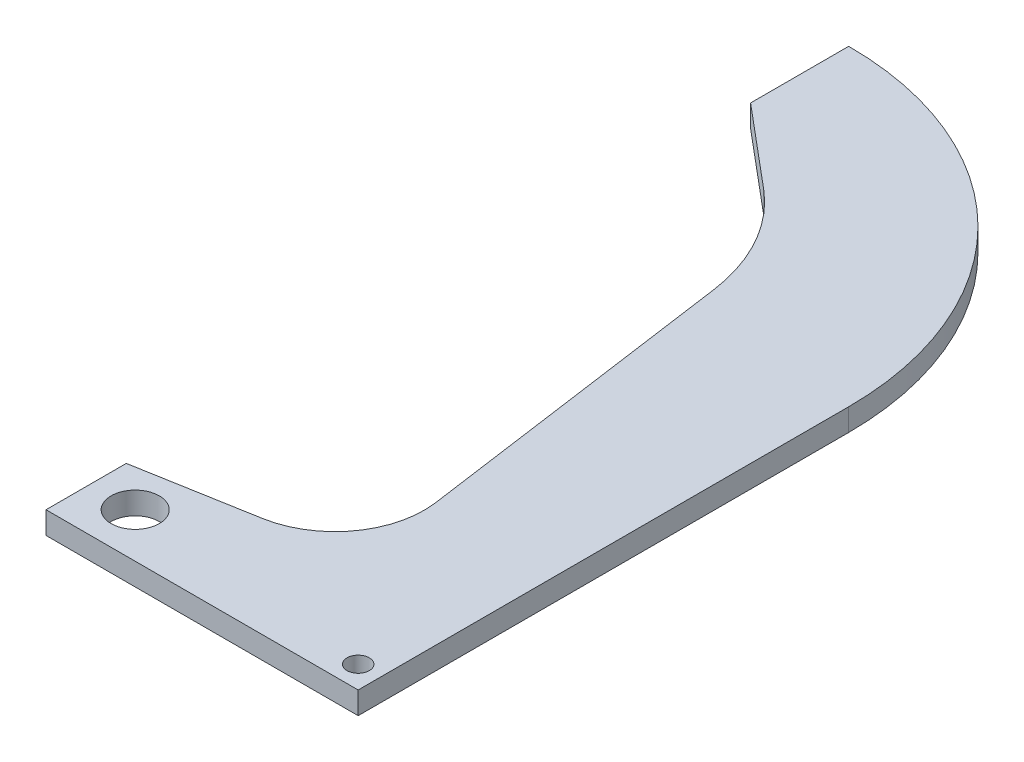
from build123d import *

# Parameters (mm, degrees)
SKETCH1_R           = 3.429
SKETCH1_R_2         = 1.5875
BOSS_EXTRUDE1_DEPTH = 3.175
CUT_EXTRUDE1_DEPTH  = 123.679962198


with BuildPart() as part:
    # Sketch1 → Boss-Extrude1 (new body)
    with BuildSketch(Plane(origin=(0, 0, 0), x_dir=(1, 0, 0), z_dir=(0, 1, 0))):
        with BuildLine():
            Line((0, 0), (44.45, 0))
            Line((44.45, 0), (44.45, 69.85))
            ThreePointArc((44.45, 69.85), (31.430896424, 101.280896424), (0, 114.3))
            Line((0, 114.3), (0, 0))
        make_face()
        with Locations((6.35, 6.35)):
            Circle(SKETCH1_R, mode=Mode.SUBTRACT)
        with Locations((41.275, 3.175)):
            Circle(SKETCH1_R_2, mode=Mode.SUBTRACT)
    extrude(amount=BOSS_EXTRUDE1_DEPTH)

    # Sketch2 → Cut-Extrude1 (cut, through all)
    with BuildSketch(Plane(origin=(0, 3.175, 0), x_dir=(1, 0, 0), z_dir=(0, 1, 0))):
        with BuildLine():
            Line((16.499594236, 14.339323634), (0, 11.43))
            Line((0, 11.43), (0, 100.33))
            Line((0, 100.33), (11.578626407, 90.614378852))
            ThreePointArc((11.578626407, 90.614378852), (17.468445655, 83.468697719), (20.405366763, 74.686600928))
            Line((20.405366763, 74.686600928), (26.8710352, 28.611257563))
            ThreePointArc((26.8710352, 28.611257563), (24.567999732, 19.380438031), (16.499594236, 14.339323634))
        make_face()
    extrude(amount=-CUT_EXTRUDE1_DEPTH, mode=Mode.SUBTRACT)


solid = part.part
